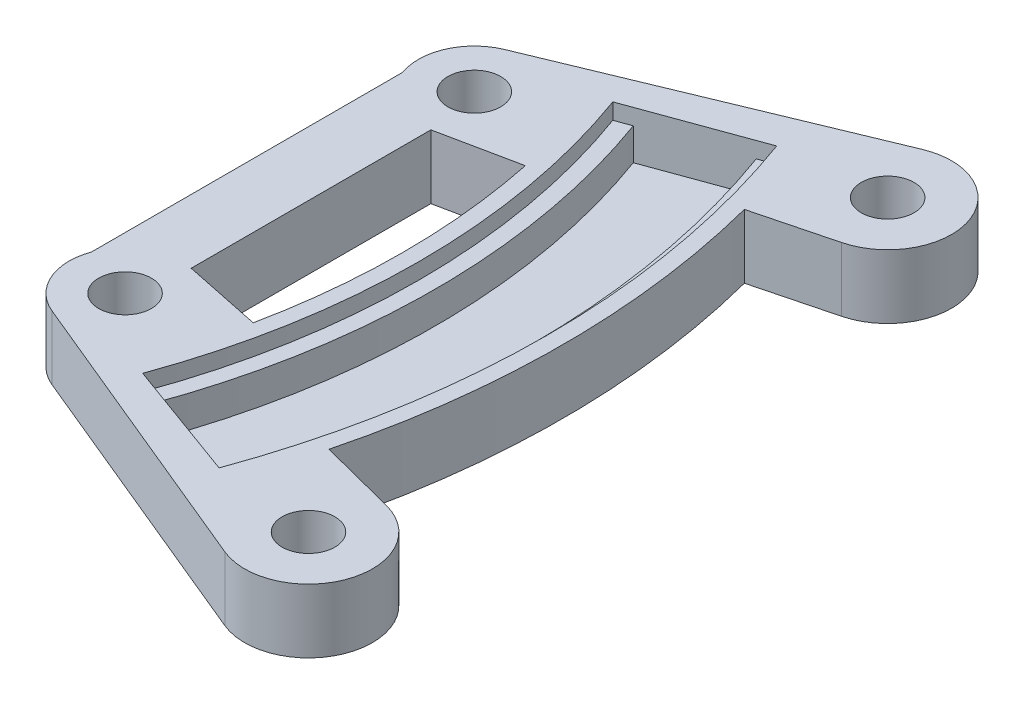
from build123d import *

# Parameters (mm, degrees)
SKETCH1_R                    = 1.65
BOSS_EXTRUDE1_DEPTH          = 4
CUT_REVOLVE1_ANGLE           = 20
CUT_REVOLVE1_OTHER_WAY_ANGLE = 20


with BuildPart() as part:
    # Sketch1 → Boss-Extrude1 (new body)
    with BuildSketch(Plane(origin=(0, 0, 0), x_dir=(1, 0, 0), z_dir=(0, 1, 0))):
        with BuildLine():
            Line((50.35011364, 12.994847302), (55.191470721, 14.24435185))
            ThreePointArc((55.191470721, 14.24435185), (57.985475608, 19.385717593), (52.661133353, 21.812955645))
            Line((52.661133353, 21.812955645), (34.183542703, 14.159286998))
            ThreePointArc((34.183542703, 14.159286998), (32.320391974, 12.337700131), (32.232236666, 9.733523103))
            Line((32.232236666, 9.733523103), (32.232236666, -9.733523103))
            ThreePointArc((32.232236666, -9.733523103), (32.320391974, -12.337700131), (34.183542703, -14.159286998))
            Line((34.183542703, -14.159286998), (52.661133353, -21.812955645))
            ThreePointArc((52.661133353, -21.812955645), (57.985475608, -19.385717593), (55.191470721, -14.24435185))
            Line((55.191470721, -14.24435185), (50.35011364, -12.994847302))
            ThreePointArc((50.35011364, -12.994847302), (52, 0), (50.35011364, 12.994847302))
        make_face()
        with Locations((54.191867083, 18.117437515)):
            Circle(SKETCH1_R, mode=Mode.SUBTRACT)
        with BuildLine():
            ThreePointArc((41.128484864, 8.511623394), (42, 0), (41.128484864, -8.511623394))
            Line((41.128484864, -8.511623394), (36.232236666, -7.498334895))
            Line((36.232236666, -7.498334895), (36.232236666, 7.498334895))
            Line((36.232236666, 7.498334895), (41.128484864, 8.511623394))
        make_face(mode=Mode.SUBTRACT)
        with Locations((54.191867083, -18.117437515)):
            Circle(SKETCH1_R, mode=Mode.SUBTRACT)
        with Locations((35.522934716, -10.925708634)):
            Circle(SKETCH1_R, mode=Mode.SUBTRACT)
        with Locations((35.522934716, 10.925708634)):
            Circle(SKETCH1_R, mode=Mode.SUBTRACT)
    extrude(amount=BOSS_EXTRUDE1_DEPTH)

    # Sketch7 → Cut-Revolve1 (revolve, cut)
    with BuildSketch(Plane.XY):
        Polygon((43, 4), (43, 3), (44, 3), (44, 1), (50, 1), (50, 3), (51, 3), (51, 4), align=None)
    revolve(axis=Axis((0, 4.2, 0), (0, -1, 0)), revolution_arc=CUT_REVOLVE1_ANGLE, mode=Mode.SUBTRACT)

    # Sketch7 → Cut-Revolve1 other way (revolve, cut)
    with BuildSketch(Plane.XY):
        Polygon((43, 4), (43, 3), (44, 3), (44, 1), (50, 1), (50, 3), (51, 3), (51, 4), align=None)
    revolve(axis=Axis((0, 4.2, 0), (0, 1, 0)), revolution_arc=CUT_REVOLVE1_OTHER_WAY_ANGLE, mode=Mode.SUBTRACT)


solid = part.part
